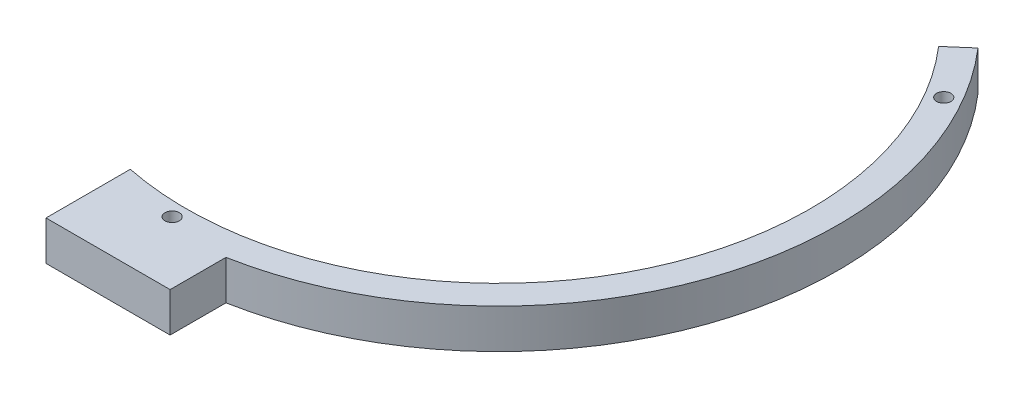
from build123d import *

# Parameters (mm, degrees)
SKETCH1_R           = 50.3
BOSS_EXTRUDE1_DEPTH = 6.35
CUT_EXTRUDE1_REACH  = 85.65
SKETCH2_R           = 1.15
CIRPATTERN1_COUNT   = 3
CUT_EXTRUDE2_REACH  = 85.65
SKETCH3_R           = 1.15


with BuildPart() as part:
    # Sketch1 → Boss-Extrude1 (new body)
    with BuildSketch(Plane(origin=(0, 0, 0), x_dir=(1, 0, 0), z_dir=(0, 1, 0))):
        with BuildLine():
            Line((-10, -53.87986637), (-10, -62.87986637))
            Line((-10, -62.87986637), (10, -62.87986637))
            Line((10, -62.87986637), (10, -53.87986637))
            ThreePointArc((10, -53.87986637), (0, 54.8), (-10, -53.87986637))
        make_face()
        Circle(SKETCH1_R, mode=Mode.SUBTRACT)
    extrude(amount=BOSS_EXTRUDE1_DEPTH)

    # Sketch2 → Cut-Extrude1 (cut, up to next)
    with BuildSketch(Plane(origin=(0, 6.35, 0), x_dir=(1, 0, 0), z_dir=(0, 1, 0)), mode=Mode.PRIVATE) as cut_extrude1_sk1:
        with Locations((0, -52.55)):
            Circle(SKETCH2_R)
    cut_extrude1_tool1 = extrude(cut_extrude1_sk1.sketch, amount=-CUT_EXTRUDE1_REACH, mode=Mode.PRIVATE) & part.part
    cut_extrude1 = cut_extrude1_tool1.solids().sort_by_distance((0, 6.35, 52.55))[0]
    add(cut_extrude1, mode=Mode.SUBTRACT)

    # CirPattern1: Cut-Extrude1 ×3 about axis
    cirpattern1_axis = Axis((0, 6.35, 0), (0, 1, 0))
    for i in range(1, CIRPATTERN1_COUNT):
        add(cut_extrude1.rotate(cirpattern1_axis, i * 360 / CIRPATTERN1_COUNT), mode=Mode.SUBTRACT)

    # Sketch3 → Cut-Extrude2 (cut, up to next)
    with BuildSketch(Plane(origin=(0, 6.35, 0), x_dir=(1, 0, 0), z_dir=(0, 1, 0)), mode=Mode.PRIVATE) as cut_extrude2_sk1:
        with BuildLine():
            ThreePointArc((41.376904985, 35.930373417), (-47.56676712, 27.21107616), (-10, -53.87986637))
            Line((-10, -53.87986637), (-10, -49.295943038))
            ThreePointArc((-10, -49.295943038), (-43.451541655, 25.338775184), (37.979166437, 32.979886548))
            Line((37.979166437, 32.979886548), (41.376904985, 35.930373417))
        make_face()
        with Locations((-45.509634969, 26.275)):
            Circle(SKETCH3_R, mode=Mode.SUBTRACT)
    cut_extrude2_tool1 = extrude(cut_extrude2_sk1.sketch, amount=-CUT_EXTRUDE2_REACH, mode=Mode.PRIVATE) & part.part
    add(cut_extrude2_tool1.solids().sort_by_distance((-43.576908, 6.35, -25.411882))[0], mode=Mode.SUBTRACT)


solid = part.part
